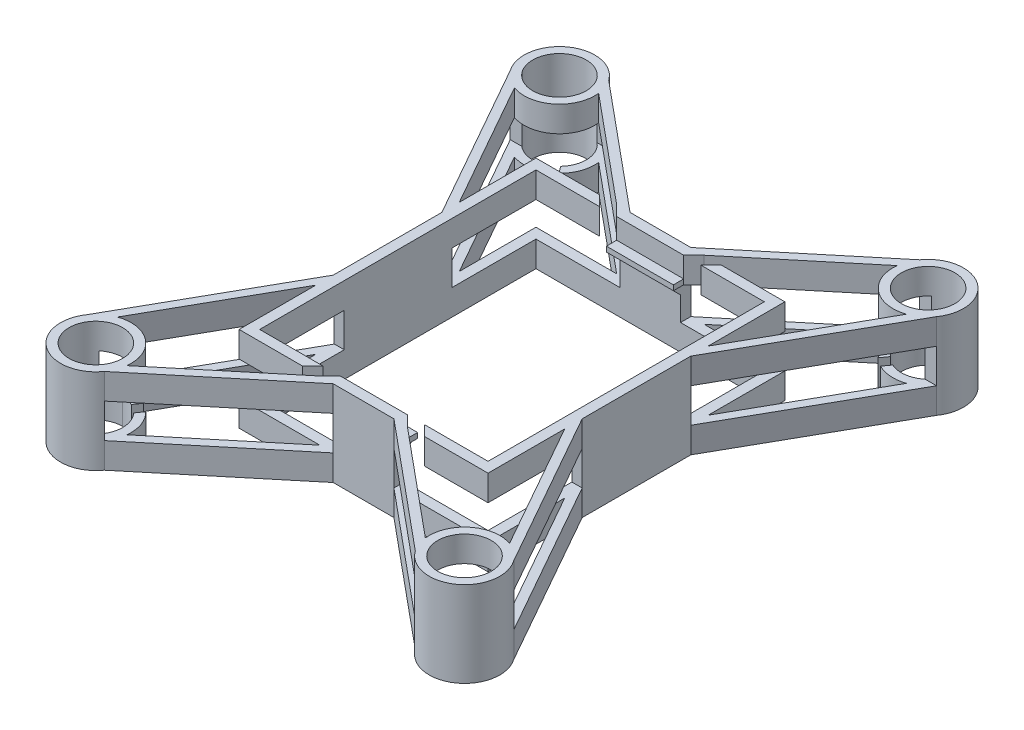
from build123d import *

# Parameters (mm, degrees)
SKETCH2_R               = 3.127
SKETCH2_W               = 26.7
SKETCH2_H               = 32.3
BOSS_EXTRUDE1_DEPTH     = 10
CUT_EXTRUDE1_DEPTH      = 52.979378239
CUT_EXTRUDE1_DEPTH_BACK = 52.979378239
CUT_EXTRUDE2_DEPTH      = 52.979378239
CUT_EXTRUDE2_DEPTH_BACK = 52.979378239
CUT_EXTRUDE3_REACH      = 60.213
CUT_EXTRUDE3_END_RADIUS = 3.127
SKETCH6_W               = 4.772967813
SKETCH6_H               = 4
CUT_EXTRUDE4_REACH      = 60.213
CUT_EXTRUDE4_END_RADIUS = 3.127
SKETCH7_W               = 4.772967813
SKETCH7_H               = 4
CUT_EXTRUDE5_REACH      = 60.213
CUT_EXTRUDE5_END_RADIUS = 3.127
SKETCH8_W               = 4.772967813
SKETCH8_H               = 4
CUT_EXTRUDE6_REACH      = 60.213
CUT_EXTRUDE6_END_RADIUS = 3.127
SKETCH9_W               = 4.772967813
SKETCH9_H               = 4
SKETCH10_W              = 1.2
SKETCH10_H              = 12.610624374
SKETCH10_W_2            = 7.1
SKETCH10_H_2            = 1.2
SKETCH10_H_3            = 12.7
BOSS_EXTRUDE2_DEPTH     = 4
CUT_EXTRUDE7_DEPTH      = 3
CUT_EXTRUDE9_DEPTH      = 3
SKETCH13_W              = 7.833075365
SKETCH13_H              = 0.6
BOSS_EXTRUDE3_DEPTH     = 1.2
CHAMFER1_SIZE           = 1.2
SKETCH14_W              = 7.833075365
SKETCH14_H              = 0.6
BOSS_EXTRUDE4_DEPTH     = 1.2
CHAMFER2_SIZE           = 1.2


with BuildPart() as part:
    # Sketch2 → Boss-Extrude1 (new body)
    with BuildSketch(Plane(origin=(0, 0, 0), x_dir=(1, 0, 0), z_dir=(0, 1, 0))):
        with BuildLine():
            Line((-34.405486348, 30.435899661), (-24.03957695, 12.074655042))
            Line((-24.03957695, 12.074655042), (-24.03957695, -0.625344958))
            Line((-24.03957695, -0.625344958), (-34.405486348, -18.986589577))
            ThreePointArc((-34.405486348, -18.986589577), (-33.424886075, -24.740002888), (-27.671446386, -23.75955739))
            Line((-27.671446386, -23.75955739), (-13.03957695, -11.625344958))
            Line((-13.03957695, -11.625344958), (-5.93957695, -11.625344958))
            Line((-5.93957695, -11.625344958), (8.692292487, -23.75955739))
            ThreePointArc((8.692292487, -23.75955739), (14.445732176, -24.740002888), (15.426332449, -18.986589577))
            Line((15.426332449, -18.986589577), (5.06042305, -0.625344958))
            Line((5.06042305, -0.625344958), (5.06042305, 12.074655042))
            Line((5.06042305, 12.074655042), (15.426332449, 30.435899661))
            ThreePointArc((15.426332449, 30.435899661), (14.445732176, 36.189312973), (8.692292487, 35.208867474))
            Line((8.692292487, 35.208867474), (-5.93957695, 23.074655042))
            Line((-5.93957695, 23.074655042), (-13.03957695, 23.074655042))
            Line((-13.03957695, 23.074655042), (-27.671446386, 35.208867474))
            ThreePointArc((-27.671446386, 35.208867474), (-33.424886075, 36.189312973), (-34.405486348, 30.435899661))
        make_face()
        with Locations(Location((-31.038402168, 32.82229299, 0), (0, 0, 270))):
            Circle(SKETCH2_R, mode=Mode.SUBTRACT)
        with Locations(Location((12.059248268, 32.82229299, 0), (0, 0, 90))):
            Circle(SKETCH2_R, mode=Mode.SUBTRACT)
        with Locations(Location((-31.038402168, -21.372982906, 0), (0, 0, 90))):
            Circle(SKETCH2_R, mode=Mode.SUBTRACT)
        with Locations(Location((12.059248268, -21.372982906, 0), (0, 0, 270))):
            Circle(SKETCH2_R, mode=Mode.SUBTRACT)
        with BuildLine():
            Line((-24.03957695, 23.074655042), (-14.606114632, 23.074655042))
            Line((-14.606114632, 23.074655042), (-26.939458612, 33.302699824))
            ThreePointArc((-26.939458612, 33.302699824), (-28.459986314, 29.599886951), (-32.406136372, 28.928524617))
            Line((-32.406136372, 28.928524617), (-24.03957695, 14.108749692))
            Line((-24.03957695, 14.108749692), (-24.03957695, 23.074655042))
        make_face(mode=Mode.SUBTRACT)
        with Locations((-9.48957695, 5.724655042)):
            Rectangle(SKETCH2_W, SKETCH2_H, mode=Mode.SUBTRACT)
        with BuildLine():
            Line((5.06042305, 23.074655042), (5.06042305, 14.108749692))
            Line((5.06042305, 14.108749692), (13.426982473, 28.928524617))
            ThreePointArc((13.426982473, 28.928524617), (9.480832414, 29.599886951), (7.960304713, 33.302699824))
            Line((7.960304713, 33.302699824), (-4.373039267, 23.074655042))
            Line((-4.373039267, 23.074655042), (5.06042305, 23.074655042))
        make_face(mode=Mode.SUBTRACT)
        with BuildLine():
            Line((-24.03957695, -11.625344958), (-14.606114632, -11.625344958))
            Line((-14.606114632, -11.625344958), (-26.939458612, -21.85338974))
            ThreePointArc((-26.939458612, -21.85338974), (-28.459986314, -18.150576866), (-32.406136372, -17.479214533))
            Line((-32.406136372, -17.479214533), (-24.03957695, -2.659439608))
            Line((-24.03957695, -2.659439608), (-24.03957695, -11.625344958))
        make_face(mode=Mode.SUBTRACT)
        with BuildLine():
            Line((7.960304713, -21.85338974), (-4.373039267, -11.625344958))
            Line((-4.373039267, -11.625344958), (5.06042305, -11.625344958))
            Line((5.06042305, -11.625344958), (5.06042305, -2.659439608))
            Line((5.06042305, -2.659439608), (13.426982473, -17.479214533))
            ThreePointArc((13.426982473, -17.479214533), (9.480832414, -18.150576866), (7.960304713, -21.85338974))
        make_face(mode=Mode.SUBTRACT)
    extrude(amount=BOSS_EXTRUDE1_DEPTH)

    # Sketch4 → Cut-Extrude1 (cut, two sides: drawn at the far end of the back side and taken through both)
    with BuildSketch(Plane(origin=(0, 0, 0), x_dir=(0, 0, -1), z_dir=(1, 0, 0)).offset(-CUT_EXTRUDE1_DEPTH_BACK)):
        Polygon((-18.986589577, 5), (-18.986589577, 7), (30.435899661, 7), (30.435899661, 5), (30.435899661, 3), (-18.986589577, 3), align=None)
    extrude(amount=CUT_EXTRUDE1_DEPTH + CUT_EXTRUDE1_DEPTH_BACK, mode=Mode.SUBTRACT)

    # Sketch5 → Cut-Extrude2 (cut, two sides: drawn at the far end of the back side and taken through both)
    with BuildSketch(Plane.XY.offset(-CUT_EXTRUDE2_DEPTH_BACK)):
        Polygon((-27.671446386, 5), (-27.671446386, 7), (8.692292487, 7), (8.692292487, 5), (8.692292487, 3), (-27.671446386, 3), align=None)
    extrude(amount=CUT_EXTRUDE2_DEPTH + CUT_EXTRUDE2_DEPTH_BACK, mode=Mode.SUBTRACT)

    # Cut-Extrude3: up to this cylinder (the profile starts outside it)
    cut_extrude3_end = Plane(origin=(-31.038402168, 5, -32.82229299), z_dir=(0, -1, 0)) * Cylinder(CUT_EXTRUDE3_END_RADIUS, 127.68, mode=Mode.PRIVATE)
    # Sketch6 → Cut-Extrude3 (cut, up to the surface)
    with BuildSketch(Plane(origin=(-27.671446386, 0, 0), x_dir=(0, 0, -1), z_dir=(1, 0, 0)), mode=Mode.PRIVATE) as cut_extrude3_sk1:
        with Locations((32.822383567, 5)):
            Rectangle(SKETCH6_W, SKETCH6_H)
    cut_extrude3_tool1 = extrude(cut_extrude3_sk1.sketch, amount=-CUT_EXTRUDE3_REACH, mode=Mode.PRIVATE) - cut_extrude3_end
    add(cut_extrude3_tool1.solids().sort_by_distance((-27.671446, 5, -32.822384))[0], mode=Mode.SUBTRACT)

    # Cut-Extrude4: up to this cylinder (the profile starts outside it)
    cut_extrude4_end = Plane(origin=(-31.038402168, 5, 21.372982906), z_dir=(0, -1, 0)) * Cylinder(CUT_EXTRUDE4_END_RADIUS, 127.68, mode=Mode.PRIVATE)
    # Sketch7 → Cut-Extrude4 (cut, up to the surface)
    with BuildSketch(Plane(origin=(-27.671446386, 0, 0), x_dir=(0, 0, -1), z_dir=(1, 0, 0)), mode=Mode.PRIVATE) as cut_extrude4_sk1:
        with Locations((-21.373073484, 5)):
            Rectangle(SKETCH7_W, SKETCH7_H)
    cut_extrude4_tool1 = extrude(cut_extrude4_sk1.sketch, amount=-CUT_EXTRUDE4_REACH, mode=Mode.PRIVATE) - cut_extrude4_end
    add(cut_extrude4_tool1.solids().sort_by_distance((-27.671446, 5, 21.373073))[0], mode=Mode.SUBTRACT)

    # Cut-Extrude5: up to this cylinder (the profile starts outside it)
    cut_extrude5_end = Plane(origin=(12.059248268, 5, -32.82229299), z_dir=(0, -1, 0)) * Cylinder(CUT_EXTRUDE5_END_RADIUS, 127.68, mode=Mode.PRIVATE)
    # Sketch8 → Cut-Extrude5 (cut, up to the surface)
    with BuildSketch(Plane.ZY.offset(-8.692292487), mode=Mode.PRIVATE) as cut_extrude5_sk1:
        with Locations((-32.822383567, 5)):
            Rectangle(SKETCH8_W, SKETCH8_H)
    cut_extrude5_tool1 = extrude(cut_extrude5_sk1.sketch, amount=-CUT_EXTRUDE5_REACH, mode=Mode.PRIVATE) - cut_extrude5_end
    add(cut_extrude5_tool1.solids().sort_by_distance((8.692292, 5, -32.822384))[0], mode=Mode.SUBTRACT)

    # Cut-Extrude6: up to this cylinder (the profile starts outside it)
    cut_extrude6_end = Plane(origin=(12.059248268, 5, 21.372982906), z_dir=(0, -1, 0)) * Cylinder(CUT_EXTRUDE6_END_RADIUS, 127.68, mode=Mode.PRIVATE)
    # Sketch9 → Cut-Extrude6 (cut, up to the surface)
    with BuildSketch(Plane.ZY.offset(-8.692292487), mode=Mode.PRIVATE) as cut_extrude6_sk1:
        with Locations((21.373073484, 5)):
            Rectangle(SKETCH9_W, SKETCH9_H)
    cut_extrude6_tool1 = extrude(cut_extrude6_sk1.sketch, amount=-CUT_EXTRUDE6_REACH, mode=Mode.PRIVATE) - cut_extrude6_end
    add(cut_extrude6_tool1.solids().sort_by_distance((8.692292, 5, 21.373073))[0], mode=Mode.SUBTRACT)

    # Sketch10 → Boss-Extrude2 (add)
    with BuildSketch(Plane(origin=(0, 3, 0), x_dir=(1, 0, 0), z_dir=(0, 1, 0))):
        with Locations((-23.43957695, 5.769342855)):
            Rectangle(SKETCH10_W, SKETCH10_H)
        with Locations((-9.48957695, 22.474655042)):
            Rectangle(SKETCH10_W_2, SKETCH10_H_2)
        with Locations((4.46042305, 5.724655042)):
            Rectangle(SKETCH10_W, SKETCH10_H_3)
        with Locations((-9.48957695, -11.025344958)):
            Rectangle(SKETCH10_W_2, SKETCH10_H_2)
    extrude(amount=BOSS_EXTRUDE2_DEPTH)

    # Sketch11 → Cut-Extrude7 (cut)
    with BuildSketch(Plane.XZ):
        with BuildLine():
            ThreePointArc((9.773467047, -30.688438916), (10.235471064, -30.282221002), (10.768064045, -29.974316112))
            Line((10.768064045, -29.974316112), (10.176165075, -29.14994678))
            ThreePointArc((10.176165075, -29.14994678), (9.652235629, -29.469917839), (9.181568077, -29.864069585))
            Line((9.181568077, -29.864069585), (9.773467047, -30.688438916))
        make_face()
        with BuildLine():
            ThreePointArc((-28.160721976, -29.864069585), (-28.631389528, -29.469917839), (-29.155318974, -29.14994678))
            Line((-29.155318974, -29.14994678), (-29.747217945, -29.974316112))
            ThreePointArc((-29.747217945, -29.974316112), (-29.214624963, -30.282221002), (-28.752620946, -30.688438916))
            Line((-28.752620946, -30.688438916), (-28.160721976, -29.864069585))
        make_face()
        with BuildLine():
            Line((-28.160721976, 18.414759501), (-28.752620946, 19.239128832))
            ThreePointArc((-28.752620946, 19.239128832), (-29.214624963, 18.832910917), (-29.747217945, 18.525006027))
            Line((-29.747217945, 18.525006027), (-29.155318974, 17.700636696))
            ThreePointArc((-29.155318974, 17.700636696), (-28.631389528, 18.020607755), (-28.160721976, 18.414759501))
        make_face()
        Polygon((11.073162581, 18.949933064), (9.804267287, 17.182674769), (8.809670289, 17.896797574), (10.078565582, 19.664055869), align=None)
    extrude(amount=-CUT_EXTRUDE7_DEPTH, mode=Mode.SUBTRACT)

    # Sketch12 → Cut-Extrude9 (cut)
    with BuildSketch(Plane(origin=(0, 10, 0), x_dir=(1, 0, 0), z_dir=(0, 1, 0))):
        Polygon((-14.606114632, 23.074655042), (-13.406114632, 21.874655042), (-15.406114632, 21.874655042), (-16.606114632, 23.074655042), align=None)
        Polygon((-3.573039267, 21.874655042), (-2.373039267, 23.074655042), (-4.373039267, 23.074655042), (-5.573039267, 21.874655042), align=None)
        Polygon((-15.406114632, -10.425344958), (-16.606114632, -11.625344958), (-14.606114632, -11.625344958), (-13.406114632, -10.425344958), align=None)
        Polygon((-5.573039267, -10.425344958), (-3.573039267, -10.425344958), (-2.373039267, -11.625344958), (-4.373039267, -11.625344958), align=None)
    extrude(amount=-CUT_EXTRUDE9_DEPTH, mode=Mode.SUBTRACT)

    # Sketch13 → Boss-Extrude3 (add)
    with BuildSketch(Plane.XY.offset(-21.874655042)):
        with Locations((-9.48957695, 7.3)):
            Rectangle(SKETCH13_W, SKETCH13_H)
    extrude(amount=BOSS_EXTRUDE3_DEPTH)

    # Chamfer1
    chamfer1_edges = [part.edges().sort_by_distance(p)[0] for p in [
        (-9.48957695, 7, -21.874655042),
    ]]
    chamfer(chamfer1_edges, length=CHAMFER1_SIZE - 0.0001)  # a hair under: the kernel refuses the full size

    # Sketch14 → Boss-Extrude4 (add)
    with BuildSketch(Plane(origin=(0, 0, 10.425344958), x_dir=(-1, 0, 0), z_dir=(0, 0, -1))):
        with Locations((9.48957695, 7.3)):
            Rectangle(SKETCH14_W, SKETCH14_H)
    extrude(amount=BOSS_EXTRUDE4_DEPTH)

    # Chamfer2
    chamfer2_edges = [part.edges().sort_by_distance(p)[0] for p in [
        (-9.48957695, 7, 10.425344958),
    ]]
    chamfer(chamfer2_edges, length=CHAMFER2_SIZE - 0.0001)  # a hair under: the kernel refuses the full size


solid = part.part
